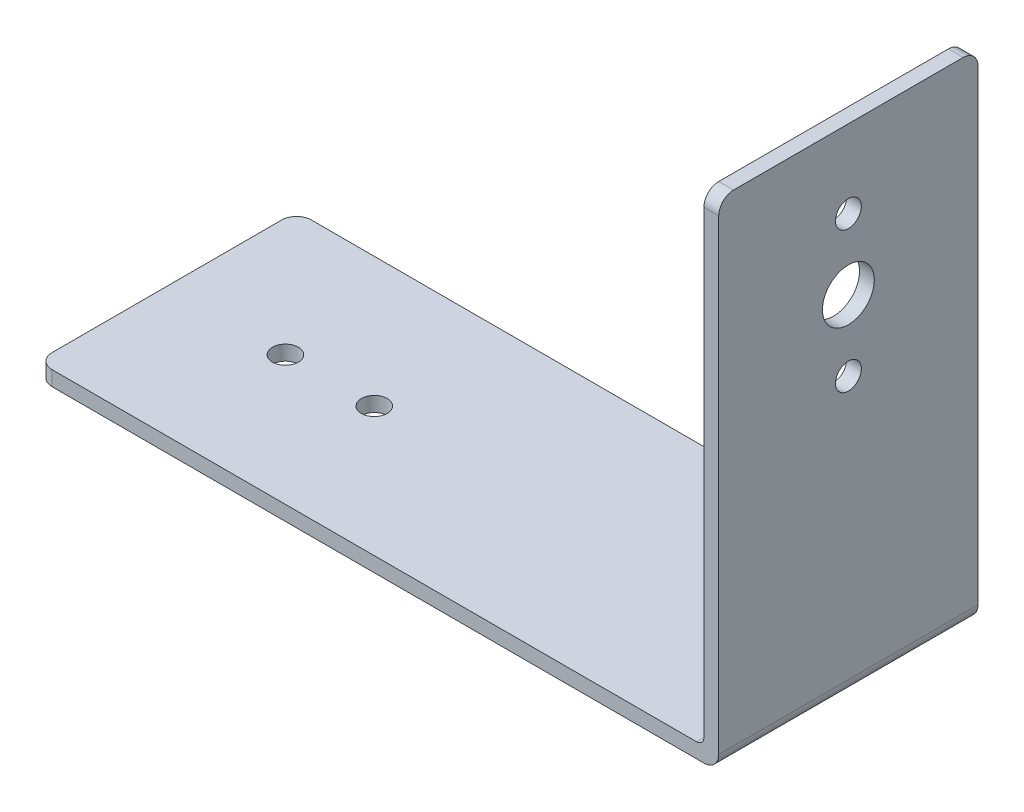
from build123d import *

# Parameters (mm, degrees)
EXTRU_MINCE1_DEPTH      = 35
CONG_1_R                = 2
CONG_3_R                = 1
ESQUISSE3_R             = 1.75
ESQUISSE3_R_2           = 3.5
ENL_V_MAT_EXTRU_2_DEPTH = 2
CONG_5_R                = 2
CONG_6_R                = 2
CONG_7_R                = 2
CONG_8_R                = 2
ESQUISSE4_R             = 1.75
ENL_V_MAT_EXTRU_3_DEPTH = 2


with BuildPart() as part:
    # Esquisse1 → Extru.-Mince1 (new body)
    with BuildSketch(Plane.XY):
        Polygon((0, 0), (90, 0), (90, 65), (92, 65), (92, -2), (0, -2), align=None)
    extrude(amount=EXTRU_MINCE1_DEPTH)

    # Congé1
    cong_1_edges = [part.edges().sort_by_distance(p)[0] for p in [
        (92, -2, 17.5),
    ]]
    fillet(cong_1_edges, radius=CONG_1_R)

    # Congé3
    cong_3_edges = [part.edges().sort_by_distance(p)[0] for p in [
        (90, 0, 17.5),
    ]]
    fillet(cong_3_edges, radius=CONG_3_R)

    # Esquisse3 → Enlèv. mat.-Extru.2 (cut)
    with BuildSketch(Plane(origin=(92, 0, 0), x_dir=(0, 0, -1), z_dir=(1, 0, 0))):
        with Locations((-17.5, 35.5)):
            Circle(ESQUISSE3_R)
        with Locations((-17.5, 54.5)):
            Circle(ESQUISSE3_R)
        with Locations((-17.5, 45)):
            Circle(ESQUISSE3_R_2)
    extrude(amount=-ENL_V_MAT_EXTRU_2_DEPTH, mode=Mode.SUBTRACT)

    # Congé5
    cong_5_edges = [part.edges().sort_by_distance(p)[0] for p in [
        (91, 65, 35),
    ]]
    fillet(cong_5_edges, radius=CONG_5_R)

    # Congé6
    cong_6_edges = [part.edges().sort_by_distance(p)[0] for p in [
        (91, 65, 0),
    ]]
    fillet(cong_6_edges, radius=CONG_6_R)

    # Congé7
    cong_7_edges = [part.edges().sort_by_distance(p)[0] for p in [
        (0, -1, 0),
    ]]
    fillet(cong_7_edges, radius=CONG_7_R)

    # Congé8
    cong_8_edges = [part.edges().sort_by_distance(p)[0] for p in [
        (0, -1, 35),
    ]]
    fillet(cong_8_edges, radius=CONG_8_R)

    # Esquisse4 → Enlèv. mat.-Extru.3 (cut)
    with BuildSketch(Plane(origin=(0, 0, 0), x_dir=(1, 0, 0), z_dir=(0, 1, 0))):
        with Locations((28, -17.5)):
            Circle(ESQUISSE4_R)
        with Locations((16, -17.5)):
            Circle(ESQUISSE4_R)
    extrude(amount=-ENL_V_MAT_EXTRU_3_DEPTH, mode=Mode.SUBTRACT)


solid = part.part
